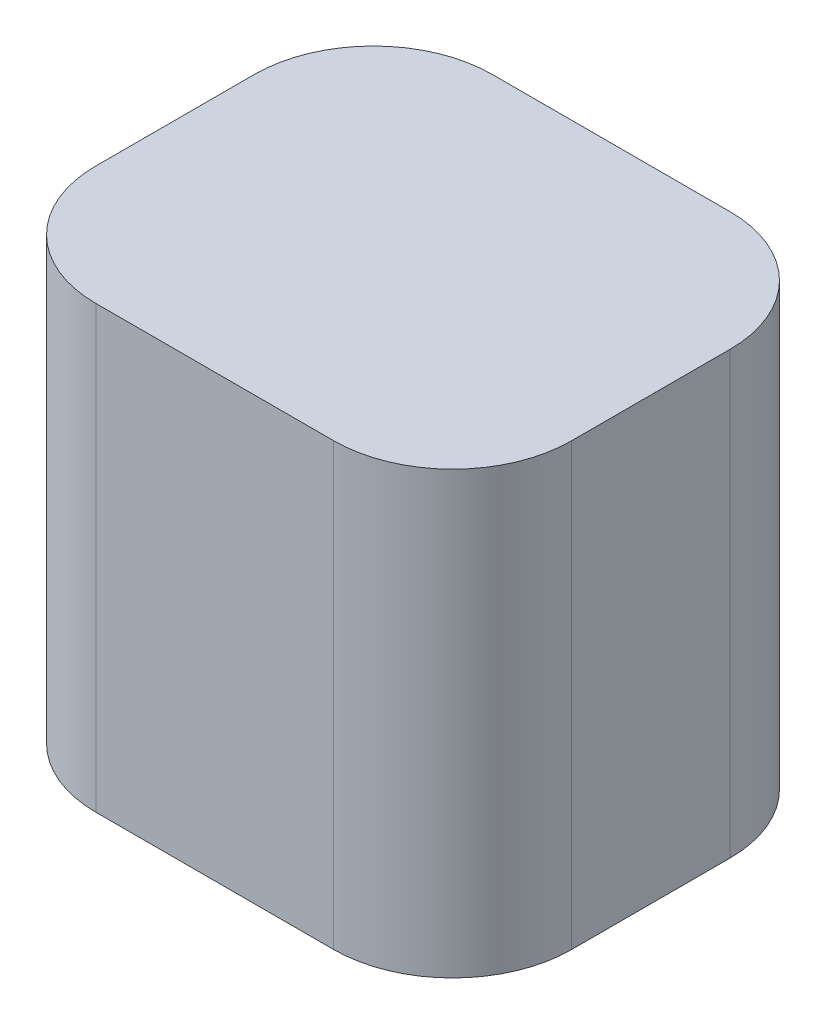
from build123d import *

# Parameters (mm, degrees)
BOSS_EXTRUDE1_DEPTH     = 10
CUT_EXTRUDE2_DEPTH      = 50.456381745
CUT_EXTRUDE2_DEPTH_BACK = 50.456381745
SKETCH3_R               = 2.5
CUT_EXTRUDE3_DEPTH      = 6
SKETCH4_R               = 2
CUT_REVOLVE1_ANGLE      = 90
SKETCH5_R               = 2
CUT_EXTRUDE4_DEPTH      = 2.805452299
FILLET1_R               = 5
SKETCH6_W               = 10
SKETCH6_H               = 29.685485307
CUT_EXTRUDE5_DEPTH      = 33
SKETCH7_W               = 19.76767366
SKETCH7_H               = 10
CUT_EXTRUDE6_DEPTH      = 48.418220859
FILLET2_R               = 3


with BuildPart() as part:
    # Sketch1 → Boss-Extrude1 (new body)
    with BuildSketch(Plane.XY):
        with BuildLine():
            Line((0, 0), (45, 0))
            Line((45, 0), (45, 11.1125))
            Line((45, 11.1125), (35, 11.1125))
            add(Edge.make_bspline(
                [(10, 11.1125), (14.576625097, 20.181995974), (30.423374903, 20.181995974), (35, 11.1125)],
                knots=[0, 0, 0, 0, 1, 1, 1, 1], degree=3))
            Line((10, 11.1125), (0, 11.1125))
            Line((0, 11.1125), (0, 0))
        make_face()
    extrude(amount=-BOSS_EXTRUDE1_DEPTH)

    # Sketch2 → Cut-Extrude2 (cut, two sides: drawn at the far end of the back side and taken through both)
    with BuildSketch(Plane.XY.offset(-CUT_EXTRUDE2_DEPTH_BACK)):
        with BuildLine():
            Line((33, 0), (33, 10.610904597))
            add(Edge.make_bspline(
                [(33, 10.610904597), (32.518518069, 11.455367364), (31.27134268, 12.982349636), (27.931157473, 15.20113612), (22.5, 16.390279221), (17.068842527, 15.20113612), (13.72865732, 12.982349636), (12.481481931, 11.455367364), (12, 10.610904597)],
                knots=[0.018308459, 0.018308459, 0.018308459, 0.018308459, 0.138731344, 0.25915423, 0.5, 0.74084577, 0.861268656, 0.981691541, 0.981691541, 0.981691541, 0.981691541], degree=3))
            Line((12, 10.610904597), (12, 0))
            Line((12, 0), (33, 0))
        make_face()
    extrude(amount=CUT_EXTRUDE2_DEPTH + CUT_EXTRUDE2_DEPTH_BACK, mode=Mode.SUBTRACT)

    # Sketch3 → Cut-Extrude3 (cut)
    with BuildSketch(Plane(origin=(12, 0, 0), x_dir=(0, 0, -1), z_dir=(1, 0, 0))):
        with Locations(Location((5, 5.305452299, 0), (0, 0, 90))):
            Circle(SKETCH3_R)
    cut_extrude3 = extrude(amount=-CUT_EXTRUDE3_DEPTH, mode=Mode.SUBTRACT)

    # Sketch4 → Cut-Revolve1 (revolve, cut)
    with BuildSketch(Plane(origin=(6, 0, 0), x_dir=(0, 0, -1), z_dir=(1, 0, 0))):
        with Locations((5, 5.305452299)):
            Circle(SKETCH4_R)
    cut_revolve1 = revolve(axis=Axis((6, 2.805452299, -5), (0, 0, 1)), revolution_arc=CUT_REVOLVE1_ANGLE, mode=Mode.SUBTRACT)

    # Sketch5 → Cut-Extrude4 (cut)
    with BuildSketch(Plane(origin=(0, 2.805452299, 0), x_dir=(1, 0, 0), z_dir=(0, 1, 0))):
        with Locations(Location((3.5, 5, 0), (0, 0, 180))):
            Circle(SKETCH5_R)
    cut_extrude4 = extrude(amount=-CUT_EXTRUDE4_DEPTH, mode=Mode.SUBTRACT)

    # Mirror1: Cut-Extrude3, Cut-Revolve1, Cut-Extrude4 across plane
    add(cut_extrude3.mirror(Plane(origin=(22.5, 0, 0), x_dir=(0, 0, 1), z_dir=(1, 0, 0))), mode=Mode.SUBTRACT)
    add(cut_revolve1.mirror(Plane(origin=(22.5, 0, 0), x_dir=(0, 0, 1), z_dir=(1, 0, 0))), mode=Mode.SUBTRACT)
    add(cut_extrude4.mirror(Plane(origin=(22.5, 0, 0), x_dir=(0, 0, 1), z_dir=(1, 0, 0))), mode=Mode.SUBTRACT)

    # Fillet1
    fillet1_edges = [part.edges().sort_by_distance(p)[0] for p in [
        (10, 11.1125, -5),
        (35, 11.1125, -5),
        (33, 10.610904597, -5),
        (12, 10.610904597, -5),
    ]]
    fillet(fillet1_edges, radius=FILLET1_R)

    # Sketch6 → Cut-Extrude5 (cut)
    with BuildSketch(Plane.ZY):
        with Locations((-5, 14.842742654)):
            Rectangle(SKETCH6_W, SKETCH6_H)
    extrude(amount=-CUT_EXTRUDE5_DEPTH, mode=Mode.SUBTRACT)

    # Sketch7 → Cut-Extrude6 (cut, through all)
    with BuildSketch(Plane(origin=(0, 11.1125, 0), x_dir=(1, 0, 0), z_dir=(0, 1, 0))):
        with Locations((35.11616317, 5)):
            Rectangle(SKETCH7_W, SKETCH7_H)
    extrude(amount=CUT_EXTRUDE6_DEPTH, mode=Mode.SUBTRACT)

    # Fillet2
    # the kernel refuses this fillet: 3 mm, written as the material it takes off along each edge
    with BuildSketch(Plane(origin=(45, -7.5, -10), x_dir=(0, 0, 1), z_dir=(0, 1, 0)), Plane(origin=(33, 18.6125, 0), x_dir=(1, 0, 0), z_dir=(0, -1, 0)), Plane(origin=(45, -7.5, 0), x_dir=(-1, 0, 0), z_dir=(0, 1, 0))) as fillet2_piece_1:
        with BuildLine():
            CenterArc((FILLET2_R, -FILLET2_R), FILLET2_R, 90, 90)
            Line((0, -FILLET2_R), (0, 0))
            Line((0, 0), (FILLET2_R, 0))
        make_face()
    extrude(amount=26.1125, mode=Mode.SUBTRACT)
    with BuildSketch(Plane(origin=(33, 18.6125, -10), x_dir=(1, 0, 0), z_dir=(0, -1, 0))) as fillet2_piece_2:
        with BuildLine():
            CenterArc((FILLET2_R, FILLET2_R), FILLET2_R, 180, 90)
            Line((0, FILLET2_R), (0, 0))
            Line((0, 0), (FILLET2_R, 0))
        make_face()
    extrude(amount=26.1125, mode=Mode.SUBTRACT)


solid = part.part
